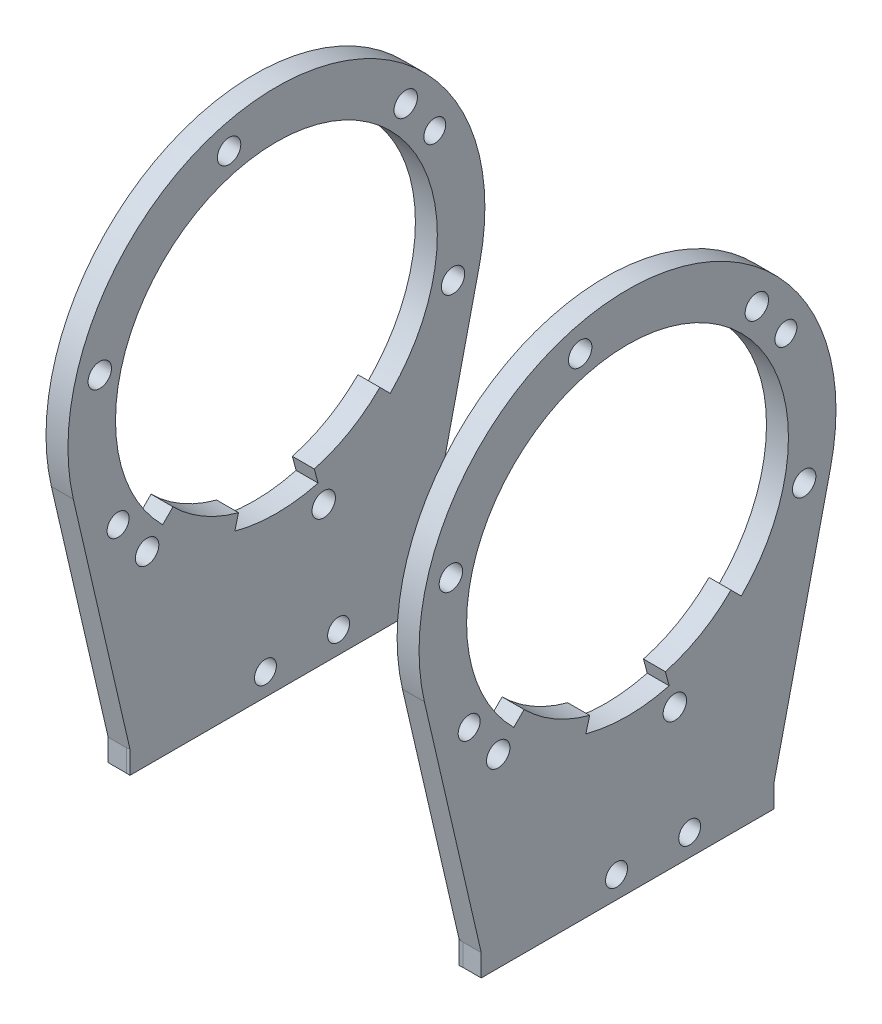
from build123d import *

# Parameters (mm, degrees)
SKETCH_1_W          = 45
SKETCH_1_H          = 40
EXTRUDE_1_DEPTH     = 3
SKETCH_2_R          = 28.5
SKETCH_2_W          = 40
SKETCH_2_H          = 3
EXTRUDE_2_DEPTH     = 3
EXTRUDE_START       = -48
SKETCH_2_4_R        = 28.5
SKETCH_2_4_W        = 40
SKETCH_2_4_H        = 3
EXTRUDE_3_DEPTH     = 3
SKETCH_3_R          = 22
SKETCH_3_R_2        = 1.6
CUT_EXTRUDE_1_DEPTH = 93.333634175
EXTRUDE_4_DEPTH     = 3
EXTRUDE_5_DEPTH     = 3
SKETCH_7_R          = 1.5
CUT_EXTRUDE_3_DEPTH = 93.333634175
SKETCH_10_W         = 40
SKETCH_10_H         = 60
EXTRUDE_6_DEPTH     = 3
SKETCH_8_R          = 15.02
CUT_EXTRUDE_4_DEPTH = 80.009493101
SKETCH_15_R         = 2.1
CUT_EXTRUDE_5_DEPTH = 80.009493101
FILLET_1_R          = 3
SKETCH_16_W         = 45
SKETCH_16_H         = 60
CUT_EXTRUDE_6_DEPTH = 10
SKETCH_17_R         = 1.5
CUT_EXTRUDE_7_DEPTH = 93.333634175


with BuildPart() as part:
    # 草图1 → 凸台-拉伸1 (new body)
    with BuildSketch(Plane(origin=(0, 0, 0), x_dir=(1, 0, 0), z_dir=(0, 1, 0))):
        Rectangle(SKETCH_1_W, SKETCH_1_H)
    extrude(amount=EXTRUDE_1_DEPTH)

    # 草图2 → 凸台-拉伸2 (add)
    with BuildSketch(Plane(origin=(22.5, 0, 0), x_dir=(0, 0, -1), z_dir=(1, 0, 0))):
        with Locations((0, 43)):
            Circle(SKETCH_2_R)
        with BuildLine():
            ThreePointArc((27.76683697, 36.577168485), (0, 14.5), (-27.76683697, 36.577168485))
            Line((-27.76683697, 36.577168485), (-20, 3))
            Line((-20, 3), (20, 3))
            Line((20, 3), (27.76683697, 36.577168485))
        make_face()
        with Locations((0, 1.5)):
            Rectangle(SKETCH_2_W, SKETCH_2_H)
    extrude(amount=EXTRUDE_2_DEPTH)

    # 草图2<4> → 凸台-拉伸3 (add)
    with BuildSketch(Plane(origin=(22.5, 0, 0), x_dir=(0, 0, -1), z_dir=(1, 0, 0)).offset(EXTRUDE_START)):
        with Locations((0, 43)):
            Circle(SKETCH_2_4_R)
        with BuildLine():
            ThreePointArc((27.76683697, 36.577168485), (0, 14.5), (-27.76683697, 36.577168485))
            Line((-27.76683697, 36.577168485), (-20, 3))
            Line((-20, 3), (20, 3))
            Line((20, 3), (27.76683697, 36.577168485))
        make_face()
        with Locations((0, 1.5)):
            Rectangle(SKETCH_2_4_W, SKETCH_2_4_H)
    extrude(amount=EXTRUDE_3_DEPTH)

    # 草图3 → 切除-拉伸1 (cut, through all)
    with BuildSketch(Plane(origin=(25.5, 0, 0), x_dir=(0, 0, -1), z_dir=(1, 0, 0))):
        with Locations((0, 43)):
            Circle(SKETCH_3_R)
        with Locations((17.67766953, 60.67766953)):
            Circle(SKETCH_3_R_2)
        with Locations((24.148145657, 36.529523872)):
            Circle(SKETCH_3_R_2)
        with Locations((6.470476128, 18.851854343)):
            Circle(SKETCH_3_R_2)
        with Locations((-17.67766953, 25.32233047)):
            Circle(SKETCH_3_R_2)
        with Locations((-24.148145657, 49.470476128)):
            Circle(SKETCH_3_R_2)
        with Locations((-6.470476128, 67.148145657)):
            Circle(SKETCH_3_R_2)
    extrude(amount=-CUT_EXTRUDE_1_DEPTH, mode=Mode.SUBTRACT)

    # 草图4 → 凸台-拉伸4 (add)
    with BuildSketch(Plane(origin=(25.5, 0, 0), x_dir=(0, 0, -1), z_dir=(1, 0, 0))):
        with BuildLine():
            Line((-14.142135624, 28.857864376), (-15.556349186, 27.443650814))
            ThreePointArc((-15.556349186, 27.443650814), (-11, 23.947441117), (-5.694018992, 21.749631822))
            Line((-5.694018992, 21.749631822), (-5.176380902, 23.681483474))
            ThreePointArc((-5.176380902, 23.681483474), (-10, 25.679491924), (-14.142135624, 28.857864376))
        make_face()
        with BuildLine():
            ThreePointArc((5.694018992, 21.749631822), (11, 23.947441117), (15.556349186, 27.443650814))
            Line((15.556349186, 27.443650814), (14.142135624, 28.857864376))
            ThreePointArc((14.142135624, 28.857864376), (10, 25.679491924), (5.176380902, 23.681483474))
            Line((5.176380902, 23.681483474), (5.694018992, 21.749631822))
        make_face()
    extrude(amount=-EXTRUDE_4_DEPTH)

    # 草图4<3> → 凸台-拉伸5 (add)
    with BuildSketch(Plane(origin=(25.5, 0, 0), x_dir=(0, 0, -1), z_dir=(1, 0, 0)).offset(EXTRUDE_START)):
        with BuildLine():
            Line((-14.142135624, 28.857864376), (-15.556349186, 27.443650814))
            ThreePointArc((-15.556349186, 27.443650814), (-11, 23.947441117), (-5.694018992, 21.749631822))
            Line((-5.694018992, 21.749631822), (-5.176380902, 23.681483474))
            ThreePointArc((-5.176380902, 23.681483474), (-10, 25.679491924), (-14.142135624, 28.857864376))
        make_face()
        with BuildLine():
            ThreePointArc((5.694018992, 21.749631822), (11, 23.947441117), (15.556349186, 27.443650814))
            Line((15.556349186, 27.443650814), (14.142135624, 28.857864376))
            ThreePointArc((14.142135624, 28.857864376), (10, 25.679491924), (5.176380902, 23.681483474))
            Line((5.176380902, 23.681483474), (5.694018992, 21.749631822))
        make_face()
    extrude(amount=-EXTRUDE_5_DEPTH)

    # 草图7 → 切除-拉伸3 (cut, through all)
    with BuildSketch(Plane(origin=(25.5, 0, 0), x_dir=(0, 0, -1), z_dir=(1, 0, 0))):
        with Locations((21.650635095, 55.5)):
            Circle(SKETCH_7_R)
        with Locations((-21.650635095, 30.5)):
            Circle(SKETCH_7_R)
    extrude(amount=-CUT_EXTRUDE_3_DEPTH, mode=Mode.SUBTRACT)

    # 草图10 → 凸台-拉伸6 (add)
    with BuildSketch(Plane(origin=(0, 3, 0), x_dir=(1, 0, 0), z_dir=(0, 1, 0))):
        Rectangle(SKETCH_10_W, SKETCH_10_H)
    extrude(amount=-EXTRUDE_6_DEPTH)

    # 草图8 → 切除-拉伸4 (cut, through all)
    with BuildSketch(Plane(origin=(0, 3, 0), x_dir=(1, 0, 0), z_dir=(0, 1, 0))):
        with Locations(Location((0, 0, 0), (0, 0, 270))):
            Circle(SKETCH_8_R)
    extrude(amount=-CUT_EXTRUDE_4_DEPTH, mode=Mode.SUBTRACT)

    # 草图15 → 切除-拉伸5 (cut, through all)
    with BuildSketch(Plane(origin=(0, 3, 0), x_dir=(1, 0, 0), z_dir=(0, 1, 0))):
        with Locations(Location((-15, 25, 0), (0, 0, 270))):
            Circle(SKETCH_15_R)
        with Locations(Location((15, 25, 0), (0, 0, 270))):
            Circle(SKETCH_15_R)
        with Locations(Location((15, -25, 0), (0, 0, 270))):
            Circle(SKETCH_15_R)
        with Locations(Location((-15, -25, 0), (0, 0, 270))):
            Circle(SKETCH_15_R)
    extrude(amount=-CUT_EXTRUDE_5_DEPTH, mode=Mode.SUBTRACT)

    # 圆角1
    # the kernel refuses this fillet: 3 mm, written as the material it adds along each edge
    with BuildSketch(Plane(origin=(20, 0, -20), x_dir=(0, 0, -1), z_dir=(0, 1, 0)), Plane(origin=(20, 3, 20), x_dir=(0, 0, 1), z_dir=(0, -1, 0))) as fillet_1_piece_1:
        with BuildLine():
            CenterArc((FILLET_1_R, -FILLET_1_R), FILLET_1_R, 90, 90)
            Line((0, -FILLET_1_R), (0, 0))
            Line((0, 0), (FILLET_1_R, 0))
        make_face()
    extrude(amount=3)
    with BuildSketch(Plane(origin=(20, -7.5, -20), x_dir=(0, 0, -1), z_dir=(0, 1, 0))) as fillet_1_piece_2_section:
        with BuildLine():
            CenterArc((FILLET_1_R, -FILLET_1_R), FILLET_1_R, 90, 90)
            Line((0, -FILLET_1_R), (0, 0))
            Line((0, 0), (FILLET_1_R, 0))
        make_face()
    fillet_1_piece_2 = extrude(amount=18, mode=Mode.PRIVATE)
    fillet_1_piece_2 = split(fillet_1_piece_2, bisect_by=Plane(origin=(22.583124197, 3, -20.019967546), z_dir=(0, 1, 0)), keep=Keep.TOP, mode=Mode.PRIVATE)
    fillet_1_piece_2 = split(fillet_1_piece_2, bisect_by=Plane(origin=(22.5, 3.043161306, -20.019967546), z_dir=(1, 0, 0)), keep=Keep.TOP, mode=Mode.PRIVATE)
    add(fillet_1_piece_2)
    with BuildSketch(Plane(origin=(20, 10.5, 20), x_dir=(0, 0, 1), z_dir=(0, -1, 0))) as fillet_1_piece_3_section:
        with BuildLine():
            CenterArc((FILLET_1_R, -FILLET_1_R), FILLET_1_R, 90, 90)
            Line((0, -FILLET_1_R), (0, 0))
            Line((0, 0), (FILLET_1_R, 0))
        make_face()
    fillet_1_piece_3 = extrude(amount=10.5, mode=Mode.PRIVATE)
    fillet_1_piece_3 = split(fillet_1_piece_3, bisect_by=Plane(origin=(22.5, 3.043161306, 20.019967546), z_dir=(1, 0, 0)), keep=Keep.TOP, mode=Mode.PRIVATE)
    add(fillet_1_piece_3)
    with BuildSketch(Plane(origin=(-20, 10.5, -20), x_dir=(-1, 0, 0), z_dir=(0, -1, 0))) as fillet_1_piece_4_section:
        with BuildLine():
            CenterArc((FILLET_1_R, FILLET_1_R), FILLET_1_R, 180, 90)
            Line((0, FILLET_1_R), (0, 0))
            Line((0, 0), (FILLET_1_R, 0))
        make_face()
    fillet_1_piece_4 = extrude(amount=10.5, mode=Mode.PRIVATE)
    fillet_1_piece_4 = split(fillet_1_piece_4, bisect_by=Plane(origin=(-22.5, 3.043161308, -20.019967545), z_dir=(-1, 0, 0)), keep=Keep.TOP, mode=Mode.PRIVATE)
    add(fillet_1_piece_4)
    with BuildSketch(Plane(origin=(-20, 3, -20), x_dir=(-1, 0, 0), z_dir=(0, -1, 0)), Plane(origin=(-20, 0, 20), x_dir=(-1, 0, 0), z_dir=(0, 1, 0))) as fillet_1_piece_5:
        with BuildLine():
            CenterArc((FILLET_1_R, FILLET_1_R), FILLET_1_R, 180, 90)
            Line((0, FILLET_1_R), (0, 0))
            Line((0, 0), (FILLET_1_R, 0))
        make_face()
    extrude(amount=3)
    with BuildSketch(Plane(origin=(-20, 0, 20), x_dir=(-1, 0, 0), z_dir=(0, 1, 0))) as fillet_1_piece_6_section:
        with BuildLine():
            CenterArc((FILLET_1_R, FILLET_1_R), FILLET_1_R, 180, 90)
            Line((0, FILLET_1_R), (0, 0))
            Line((0, 0), (FILLET_1_R, 0))
        make_face()
    fillet_1_piece_6 = extrude(amount=10.5, mode=Mode.PRIVATE)
    fillet_1_piece_6 = split(fillet_1_piece_6, bisect_by=Plane(origin=(-22.5, 1.5, 20.012572796), z_dir=(-1, 0, 0)), keep=Keep.TOP, mode=Mode.PRIVATE)
    add(fillet_1_piece_6)
    # the kernel refuses this fillet: 3 mm, written as the material it takes off along each edge
    with BuildSketch(Plane(origin=(20, 10.5, -30), x_dir=(-1, 0, 0), z_dir=(0, -1, 0)), Plane(origin=(-20, 10.5, 30), x_dir=(1, 0, 0), z_dir=(0, -1, 0)), Plane(origin=(20, 10.5, 30), x_dir=(0, 0, -1), z_dir=(0, -1, 0))) as fillet_1_2_piece_1:
        with BuildLine():
            CenterArc((FILLET_1_R, -FILLET_1_R), FILLET_1_R, 90, 90)
            Line((0, -FILLET_1_R), (0, 0))
            Line((0, 0), (FILLET_1_R, 0))
        make_face()
    extrude(amount=18, mode=Mode.SUBTRACT)
    with BuildSketch(Plane(origin=(-20, 10.5, -30), x_dir=(1, 0, 0), z_dir=(0, -1, 0))) as fillet_1_2_piece_2:
        with BuildLine():
            CenterArc((FILLET_1_R, FILLET_1_R), FILLET_1_R, 180, 90)
            Line((0, FILLET_1_R), (0, 0))
            Line((0, 0), (FILLET_1_R, 0))
        make_face()
    extrude(amount=18, mode=Mode.SUBTRACT)

    # 草图16 → 切除-拉伸6 (cut)
    with BuildSketch(Plane(origin=(0, 3, 0), x_dir=(1, 0, 0), z_dir=(0, 1, 0))):
        Rectangle(SKETCH_16_W, SKETCH_16_H)
    extrude(amount=-CUT_EXTRUDE_6_DEPTH, mode=Mode.SUBTRACT)


with BuildPart() as cut_extrude_6_piece_1:
    # of the separate pieces the step leaves, piece 1, a body of its own (cut_extrude_6_pieces)
    add(part.part.solids().sort_by_distance((-23, 0, 20))[0])


with BuildPart() as cut_extrude_6_piece_2:
    # of the separate pieces the step leaves, piece 2, a body of its own (cut_extrude_6_pieces)
    add(part.part.solids().sort_by_distance((22.5, 0, 20.041960108))[0])


with BuildPart() as cut_extrude_7_tool:
    # 草图17 → 切除-拉伸7 (new, through all)
    with BuildSketch(Plane.ZY.offset(25.5)):
        with Locations((-8.5, 3)):
            Circle(SKETCH_17_R)
        with Locations((1.5, 3)):
            Circle(SKETCH_17_R)
    extrude(amount=-CUT_EXTRUDE_7_DEPTH)


with BuildPart() as cut_extrude_6_piece_1_1:
    add(cut_extrude_6_piece_1.part)

    # 切除-拉伸7: cut by cut_extrude_7_tool
    add(cut_extrude_7_tool.part, mode=Mode.SUBTRACT)


with BuildPart() as cut_extrude_6_piece_2_1:
    add(cut_extrude_6_piece_2.part)

    # 切除-拉伸7: cut by cut_extrude_7_tool
    add(cut_extrude_7_tool.part, mode=Mode.SUBTRACT)


solid = Compound([cut_extrude_6_piece_1_1.part, cut_extrude_6_piece_2_1.part])
